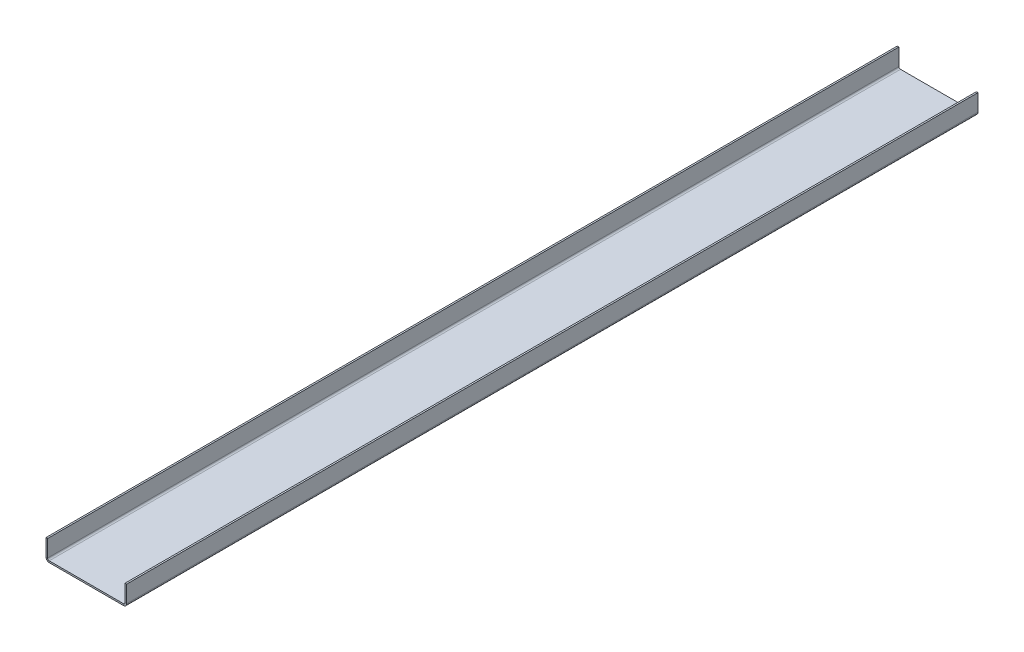
from build123d import *

# Parameters (mm, degrees)
BASE_FLANGE1_DEPTH = 1055


# Sheet-metal steps are written as plain solids
with BuildPart() as part:
    # Sketch1 → Base-Flange1 (new body)
    with BuildSketch(Plane.XY):
        with BuildLine():
            Line((0, 25), (0, 4))
            ThreePointArc((0, 4), (1.171572875, 1.171572875), (4, 0))
            Line((4, 0), (96, 0))
            ThreePointArc((96, 0), (98.828427125, 1.171572875), (100, 4))
            Line((100, 4), (100, 25))
            Line((100, 25), (98, 25))
            Line((98, 25), (98, 4))
            ThreePointArc((98, 4), (97.414213562, 2.585786438), (96, 2))
            Line((96, 2), (4, 2))
            ThreePointArc((4, 2), (2.585786438, 2.585786438), (2, 4))
            Line((2, 4), (2, 25))
            Line((2, 25), (0, 25))
        make_face()
    extrude(amount=BASE_FLANGE1_DEPTH)


solid = part.part
